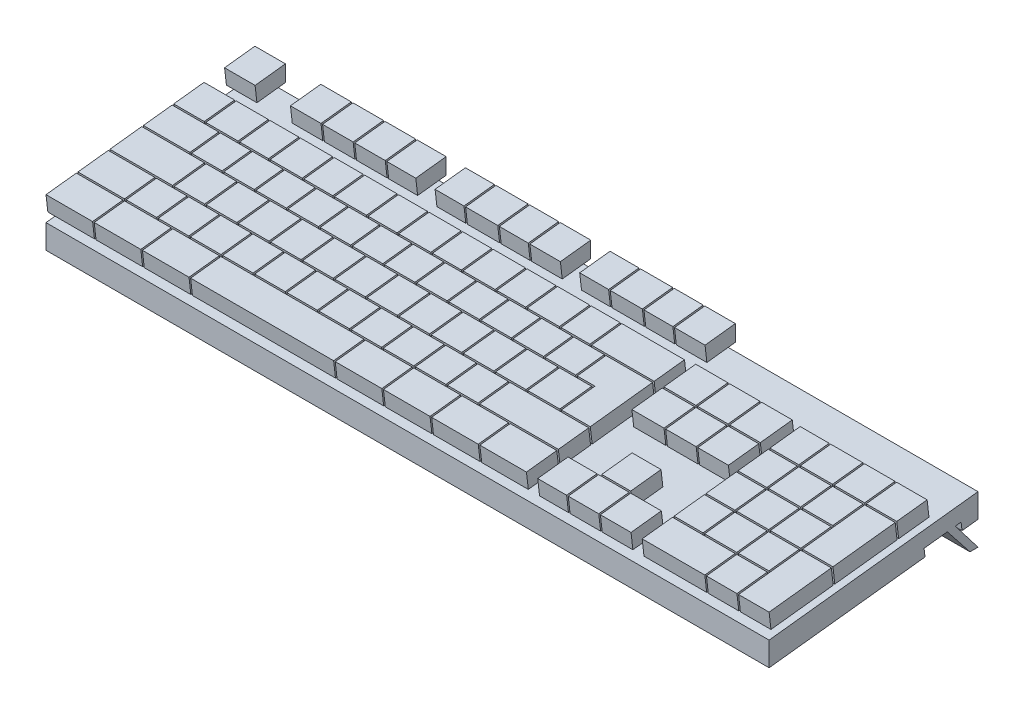
from build123d import *

# Parameters (mm, degrees)
BOSS_EXTRUDE1_DEPTH           = 450
SKETCH2_W                     = 450
SKETCH2_H                     = 23.19613836
CUT_EXTRUDE3_DEPTH            = 5
BOSS_EXTRUDE4_DEPTH           = 450
CUT_EXTRUDE_THIN2_START       = -10
CUT_EXTRUDE_THIN2_OUTLINE_W   = 19
CUT_EXTRUDE_THIN2_OUTLINE_H   = 19
CUT_EXTRUDE_THIN2_OUTLINE_H_2 = 20
CUT_EXTRUDE_THIN2_OUTLINE_H_3 = 18
CUT_EXTRUDE_THIN2_OUTLINE_W_2 = 20
CUT_EXTRUDE_THIN2_OUTLINE_W_3 = 18
CUT_EXTRUDE_THIN2_OUTLINE_W_4 = 49
CUT_EXTRUDE_THIN2_OUTLINE_W_5 = 39
CUT_EXTRUDE_THIN2_OUTLINE_W_6 = 62.079147308
CUT_EXTRUDE_THIN2_OUTLINE_H_4 = 42
CUT_EXTRUDE_THIN2_OUTLINE_W_7 = 19.079147308
CUT_EXTRUDE_THIN2_DEPTH       = 10
CUT_EXTRUDE4_DEPTH            = 450
SKETCH11_W                    = 62.079147308
SKETCH11_H                    = 42
CUT_EXTRUDE6_DEPTH            = 10
CUT_EXTRUDE7_DEPTH            = 450


# Read off the part's stored shape, not the designer's step: Cut-Extrude-Thin2
with BuildPart() as part:
    # Sketch1 → Boss-Extrude1 (new body)
    with BuildSketch(Plane(origin=(0, 0, 0), x_dir=(0, 0, -1), z_dir=(1, 0, 0))):
        Polygon((0, 0), (0, 30), (130, 45), (130, 15), align=None)
    extrude(amount=BOSS_EXTRUDE1_DEPTH)

    # Sketch2 → Cut-Extrude3 (cut)
    with BuildSketch(Plane(origin=(0, 0, 0), x_dir=(1, 0, 0), z_dir=(0, -0.9934089358711312, -0.11462410798513054))):
        with Locations((225, -109.264454103)):
            Rectangle(SKETCH2_W, SKETCH2_H)
    extrude(amount=-CUT_EXTRUDE3_DEPTH, mode=Mode.SUBTRACT)

    # Sketch5 → Boss-Extrude4 (add)
    with BuildSketch(Plane(origin=(450, 0, 0), x_dir=(0, 0, -1), z_dir=(1, 0, 0))):
        Polygon((130, 0), (115.88077903, 18.404033091), (110.913734351, 17.830912551), (125, 0), align=None)
    extrude(amount=-BOSS_EXTRUDE4_DEPTH)

    # Cut-Extrude-Thin2 outline → Cut-Extrude-Thin2 (cut)
    # profile 1 of 6: a face of its own
    with BuildSketch(Plane(origin=(0, 29.605839416, 3.416058394), x_dir=(1, 0, 0), z_dir=(0, 0.9934089358711312, 0.11462410798513054)).offset(CUT_EXTRUDE_THIN2_START)):
        Polygon((29, 23.43872324), (0, 23.43872324), (0, 22.43872324), (29, 22.43872324), (29, 3.43872324), (30, 3.43872324), (30, 22.43872324), (59, 22.43872324), (59, 3.43872324), (60, 3.43872324), (60, 22.43872324), (89, 22.43872324), (89, 3.43872324), (90, 3.43872324), (90, 22.43872324), (179, 22.43872324), (179, 3.43872324), (180, 3.43872324), (180, 22.43872324), (209, 22.43872324), (209, 3.43872324), (210, 3.43872324), (210, 22.43872324), (239, 22.43872324), (239, 3.43872324), (240, 3.43872324), (240, 22.43872324), (269, 22.43872324), (269, 3.43872324), (270, 3.43872324), (270, 22.43872324), (299, 22.43872324), (299, 2.43872324), (306, 2.43872324), (306, 22.43872324), (324, 22.43872324), (324, 3.43872324), (325, 3.43872324), (325, 22.43872324), (344, 22.43872324), (344, 3.43872324), (345, 3.43872324), (345, 22.43872324), (364.079147308, 22.43872324), (364.079147308, 2.43872324), (371, 2.43872324), (371, 22.43872324), (410, 22.43872324), (410, 3.43872324), (411, 3.43872324), (411, 22.43872324), (430, 22.43872324), (430, 3.43872324), (431, 3.43872324), (431, 42.43872324), (450, 42.43872324), (450, 43.43872324), (431, 43.43872324), (431, 82.43872324), (450, 82.43872324), (450, 83.43872324), (431, 83.43872324), (431, 102.43872324), (450, 102.43872324), (450, 103.43872324), (370, 103.43872324), (370, 3.43872324), (365.079147308, 3.43872324), (365.079147308, 23.43872324), (345, 23.43872324), (345, 43.43872324), (325, 43.43872324), (325, 23.43872324), (305, 23.43872324), (305, 3.43872324), (300, 3.43872324), (300, 103.43872324), (0, 103.43872324), (0, 102.43872324), (19, 102.43872324), (19, 83.43872324), (0, 83.43872324), (0, 82.43872324), (29, 82.43872324), (29, 64.43872324), (0, 64.43872324), (0, 63.43872324), (39, 63.43872324), (39, 43.43872324), (0, 43.43872324), (0, 42.43872324), (29, 42.43872324), align=None)
        with Locations((39.5, 32.93872324)):
            Rectangle(CUT_EXTRUDE_THIN2_OUTLINE_W, CUT_EXTRUDE_THIN2_OUTLINE_H, mode=Mode.SUBTRACT)
        with Locations((59.5, 32.93872324)):
            Rectangle(CUT_EXTRUDE_THIN2_OUTLINE_W, CUT_EXTRUDE_THIN2_OUTLINE_H, mode=Mode.SUBTRACT)
        with Locations((49.5, 53.43872324)):
            Rectangle(CUT_EXTRUDE_THIN2_OUTLINE_W, CUT_EXTRUDE_THIN2_OUTLINE_H_2, mode=Mode.SUBTRACT)
        with Locations((79.5, 32.93872324)):
            Rectangle(CUT_EXTRUDE_THIN2_OUTLINE_W, CUT_EXTRUDE_THIN2_OUTLINE_H, mode=Mode.SUBTRACT)
        with Locations((69.5, 53.43872324)):
            Rectangle(CUT_EXTRUDE_THIN2_OUTLINE_W, CUT_EXTRUDE_THIN2_OUTLINE_H_2, mode=Mode.SUBTRACT)
        with Locations((99.5, 32.93872324)):
            Rectangle(CUT_EXTRUDE_THIN2_OUTLINE_W, CUT_EXTRUDE_THIN2_OUTLINE_H, mode=Mode.SUBTRACT)
        with Locations((89.5, 53.43872324)):
            Rectangle(CUT_EXTRUDE_THIN2_OUTLINE_W, CUT_EXTRUDE_THIN2_OUTLINE_H_2, mode=Mode.SUBTRACT)
        with Locations((119.5, 32.93872324)):
            Rectangle(CUT_EXTRUDE_THIN2_OUTLINE_W, CUT_EXTRUDE_THIN2_OUTLINE_H, mode=Mode.SUBTRACT)
        with Locations((139.5, 32.93872324)):
            Rectangle(CUT_EXTRUDE_THIN2_OUTLINE_W, CUT_EXTRUDE_THIN2_OUTLINE_H, mode=Mode.SUBTRACT)
        with Locations((159.5, 32.93872324)):
            Rectangle(CUT_EXTRUDE_THIN2_OUTLINE_W, CUT_EXTRUDE_THIN2_OUTLINE_H, mode=Mode.SUBTRACT)
        with Locations((179.5, 32.93872324)):
            Rectangle(CUT_EXTRUDE_THIN2_OUTLINE_W, CUT_EXTRUDE_THIN2_OUTLINE_H, mode=Mode.SUBTRACT)
        with Locations((39.5, 73.43872324)):
            Rectangle(CUT_EXTRUDE_THIN2_OUTLINE_W, CUT_EXTRUDE_THIN2_OUTLINE_H_3, mode=Mode.SUBTRACT)
        with Locations((30, 92.93872324)):
            Rectangle(CUT_EXTRUDE_THIN2_OUTLINE_W_2, CUT_EXTRUDE_THIN2_OUTLINE_H, mode=Mode.SUBTRACT)
        with Locations((50, 92.93872324)):
            Rectangle(CUT_EXTRUDE_THIN2_OUTLINE_W_3, CUT_EXTRUDE_THIN2_OUTLINE_H, mode=Mode.SUBTRACT)
        with Locations((59.5, 73.43872324)):
            Rectangle(CUT_EXTRUDE_THIN2_OUTLINE_W, CUT_EXTRUDE_THIN2_OUTLINE_H_3, mode=Mode.SUBTRACT)
        with Locations((109.5, 53.43872324)):
            Rectangle(CUT_EXTRUDE_THIN2_OUTLINE_W, CUT_EXTRUDE_THIN2_OUTLINE_H_2, mode=Mode.SUBTRACT)
        with Locations((129.5, 53.43872324)):
            Rectangle(CUT_EXTRUDE_THIN2_OUTLINE_W, CUT_EXTRUDE_THIN2_OUTLINE_H_2, mode=Mode.SUBTRACT)
        with Locations((149.5, 53.43872324)):
            Rectangle(CUT_EXTRUDE_THIN2_OUTLINE_W, CUT_EXTRUDE_THIN2_OUTLINE_H_2, mode=Mode.SUBTRACT)
        with Locations((169.5, 53.43872324)):
            Rectangle(CUT_EXTRUDE_THIN2_OUTLINE_W, CUT_EXTRUDE_THIN2_OUTLINE_H_2, mode=Mode.SUBTRACT)
        with Locations((199.5, 32.93872324)):
            Rectangle(CUT_EXTRUDE_THIN2_OUTLINE_W, CUT_EXTRUDE_THIN2_OUTLINE_H, mode=Mode.SUBTRACT)
        with Locations((70, 92.93872324)):
            Rectangle(CUT_EXTRUDE_THIN2_OUTLINE_W_2, CUT_EXTRUDE_THIN2_OUTLINE_H, mode=Mode.SUBTRACT)
        with Locations((79.5, 73.43872324)):
            Rectangle(CUT_EXTRUDE_THIN2_OUTLINE_W, CUT_EXTRUDE_THIN2_OUTLINE_H_3, mode=Mode.SUBTRACT)
        with Locations((90, 92.93872324)):
            Rectangle(CUT_EXTRUDE_THIN2_OUTLINE_W_3, CUT_EXTRUDE_THIN2_OUTLINE_H, mode=Mode.SUBTRACT)
        with Locations((99.5, 73.43872324)):
            Rectangle(CUT_EXTRUDE_THIN2_OUTLINE_W, CUT_EXTRUDE_THIN2_OUTLINE_H_3, mode=Mode.SUBTRACT)
        with Locations((189.5, 53.43872324)):
            Rectangle(CUT_EXTRUDE_THIN2_OUTLINE_W, CUT_EXTRUDE_THIN2_OUTLINE_H_2, mode=Mode.SUBTRACT)
        with Locations((219.5, 32.93872324)):
            Rectangle(CUT_EXTRUDE_THIN2_OUTLINE_W, CUT_EXTRUDE_THIN2_OUTLINE_H, mode=Mode.SUBTRACT)
        with Locations((209.5, 53.43872324)):
            Rectangle(CUT_EXTRUDE_THIN2_OUTLINE_W, CUT_EXTRUDE_THIN2_OUTLINE_H_2, mode=Mode.SUBTRACT)
        with Locations((239.5, 32.93872324)):
            Rectangle(CUT_EXTRUDE_THIN2_OUTLINE_W, CUT_EXTRUDE_THIN2_OUTLINE_H, mode=Mode.SUBTRACT)
        with Locations((110, 92.93872324)):
            Rectangle(CUT_EXTRUDE_THIN2_OUTLINE_W_2, CUT_EXTRUDE_THIN2_OUTLINE_H, mode=Mode.SUBTRACT)
        with Locations((119.5, 73.43872324)):
            Rectangle(CUT_EXTRUDE_THIN2_OUTLINE_W, CUT_EXTRUDE_THIN2_OUTLINE_H_3, mode=Mode.SUBTRACT)
        with Locations((130, 92.93872324)):
            Rectangle(CUT_EXTRUDE_THIN2_OUTLINE_W_3, CUT_EXTRUDE_THIN2_OUTLINE_H, mode=Mode.SUBTRACT)
        with Locations((139.5, 73.43872324)):
            Rectangle(CUT_EXTRUDE_THIN2_OUTLINE_W, CUT_EXTRUDE_THIN2_OUTLINE_H_3, mode=Mode.SUBTRACT)
        with Locations((150, 92.93872324)):
            Rectangle(CUT_EXTRUDE_THIN2_OUTLINE_W_2, CUT_EXTRUDE_THIN2_OUTLINE_H, mode=Mode.SUBTRACT)
        with Locations((159.5, 73.43872324)):
            Rectangle(CUT_EXTRUDE_THIN2_OUTLINE_W, CUT_EXTRUDE_THIN2_OUTLINE_H_3, mode=Mode.SUBTRACT)
        with Locations((179.5, 73.43872324)):
            Rectangle(CUT_EXTRUDE_THIN2_OUTLINE_W, CUT_EXTRUDE_THIN2_OUTLINE_H_3, mode=Mode.SUBTRACT)
        with Locations((170, 92.93872324)):
            Rectangle(CUT_EXTRUDE_THIN2_OUTLINE_W_3, CUT_EXTRUDE_THIN2_OUTLINE_H, mode=Mode.SUBTRACT)
        with Locations((229.5, 53.43872324)):
            Rectangle(CUT_EXTRUDE_THIN2_OUTLINE_W, CUT_EXTRUDE_THIN2_OUTLINE_H_2, mode=Mode.SUBTRACT)
        with Locations((274.5, 32.93872324)):
            Rectangle(CUT_EXTRUDE_THIN2_OUTLINE_W_4, CUT_EXTRUDE_THIN2_OUTLINE_H, mode=Mode.SUBTRACT)
        with Locations((190, 92.93872324)):
            Rectangle(CUT_EXTRUDE_THIN2_OUTLINE_W_2, CUT_EXTRUDE_THIN2_OUTLINE_H, mode=Mode.SUBTRACT)
        with Locations((199.5, 73.43872324)):
            Rectangle(CUT_EXTRUDE_THIN2_OUTLINE_W, CUT_EXTRUDE_THIN2_OUTLINE_H_3, mode=Mode.SUBTRACT)
        with Locations((249.5, 53.43872324)):
            Rectangle(CUT_EXTRUDE_THIN2_OUTLINE_W, CUT_EXTRUDE_THIN2_OUTLINE_H_2, mode=Mode.SUBTRACT)
        with Locations((210, 92.93872324)):
            Rectangle(CUT_EXTRUDE_THIN2_OUTLINE_W_3, CUT_EXTRUDE_THIN2_OUTLINE_H, mode=Mode.SUBTRACT)
        with Locations((219.5, 73.43872324)):
            Rectangle(CUT_EXTRUDE_THIN2_OUTLINE_W, CUT_EXTRUDE_THIN2_OUTLINE_H_3, mode=Mode.SUBTRACT)
        with Locations((230, 92.93872324)):
            Rectangle(CUT_EXTRUDE_THIN2_OUTLINE_W_2, CUT_EXTRUDE_THIN2_OUTLINE_H, mode=Mode.SUBTRACT)
        with Locations((239.5, 73.43872324)):
            Rectangle(CUT_EXTRUDE_THIN2_OUTLINE_W, CUT_EXTRUDE_THIN2_OUTLINE_H_3, mode=Mode.SUBTRACT)
        with Locations((270, 53.43872324)):
            Rectangle(CUT_EXTRUDE_THIN2_OUTLINE_W_2, CUT_EXTRUDE_THIN2_OUTLINE_H_2, mode=Mode.SUBTRACT)
        Polygon((299, 43.43872324), (281, 43.43872324), (281, 64.43872324), (270, 64.43872324), (270, 82.43872324), (299, 82.43872324), align=None, mode=Mode.SUBTRACT)
        with Locations((250, 92.93872324)):
            Rectangle(CUT_EXTRUDE_THIN2_OUTLINE_W_3, CUT_EXTRUDE_THIN2_OUTLINE_H, mode=Mode.SUBTRACT)
        with Locations((259.5, 73.43872324)):
            Rectangle(CUT_EXTRUDE_THIN2_OUTLINE_W, CUT_EXTRUDE_THIN2_OUTLINE_H_3, mode=Mode.SUBTRACT)
        with Locations((279.5, 92.93872324)):
            Rectangle(CUT_EXTRUDE_THIN2_OUTLINE_W_5, CUT_EXTRUDE_THIN2_OUTLINE_H, mode=Mode.SUBTRACT)
        with Locations((335, 32.93872324)):
            Rectangle(CUT_EXTRUDE_THIN2_OUTLINE_W_3, CUT_EXTRUDE_THIN2_OUTLINE_H, mode=Mode.SUBTRACT)
        with Locations((380, 32.93872324)):
            Rectangle(CUT_EXTRUDE_THIN2_OUTLINE_W_3, CUT_EXTRUDE_THIN2_OUTLINE_H, mode=Mode.SUBTRACT)
        with Locations((400, 32.93872324)):
            Rectangle(CUT_EXTRUDE_THIN2_OUTLINE_W_2, CUT_EXTRUDE_THIN2_OUTLINE_H, mode=Mode.SUBTRACT)
        with Locations((380, 52.93872324)):
            Rectangle(CUT_EXTRUDE_THIN2_OUTLINE_W_3, CUT_EXTRUDE_THIN2_OUTLINE_H, mode=Mode.SUBTRACT)
        with Locations((420.5, 32.93872324)):
            Rectangle(CUT_EXTRUDE_THIN2_OUTLINE_W, CUT_EXTRUDE_THIN2_OUTLINE_H, mode=Mode.SUBTRACT)
        with Locations((380, 72.93872324)):
            Rectangle(CUT_EXTRUDE_THIN2_OUTLINE_W_3, CUT_EXTRUDE_THIN2_OUTLINE_H, mode=Mode.SUBTRACT)
        with Locations((400, 52.93872324)):
            Rectangle(CUT_EXTRUDE_THIN2_OUTLINE_W_2, CUT_EXTRUDE_THIN2_OUTLINE_H, mode=Mode.SUBTRACT)
        with Locations((420.5, 52.93872324)):
            Rectangle(CUT_EXTRUDE_THIN2_OUTLINE_W, CUT_EXTRUDE_THIN2_OUTLINE_H, mode=Mode.SUBTRACT)
        with Locations((380, 92.93872324)):
            Rectangle(CUT_EXTRUDE_THIN2_OUTLINE_W_3, CUT_EXTRUDE_THIN2_OUTLINE_H, mode=Mode.SUBTRACT)
        with Locations((400, 72.93872324)):
            Rectangle(CUT_EXTRUDE_THIN2_OUTLINE_W_2, CUT_EXTRUDE_THIN2_OUTLINE_H, mode=Mode.SUBTRACT)
        with Locations((420.5, 72.93872324)):
            Rectangle(CUT_EXTRUDE_THIN2_OUTLINE_W, CUT_EXTRUDE_THIN2_OUTLINE_H, mode=Mode.SUBTRACT)
        with Locations((400, 92.93872324)):
            Rectangle(CUT_EXTRUDE_THIN2_OUTLINE_W_2, CUT_EXTRUDE_THIN2_OUTLINE_H, mode=Mode.SUBTRACT)
        with Locations((420.5, 92.93872324)):
            Rectangle(CUT_EXTRUDE_THIN2_OUTLINE_W, CUT_EXTRUDE_THIN2_OUTLINE_H, mode=Mode.SUBTRACT)
    # profile 2 of 6: a face of its own
    with BuildSketch(Plane(origin=(0, 29.605839416, 3.416058394), x_dir=(1, 0, 0), z_dir=(0, 0.9934089358711312, 0.11462410798513054)).offset(CUT_EXTRUDE_THIN2_START)):
        Polygon((0, 115.301246523), (0, 114.301246523), (20, 114.301246523), (20, 134.301246523), (19, 134.301246523), (19, 115.301246523), align=None)
    # profile 3 of 6: a face of its own
    with BuildSketch(Plane(origin=(0, 29.605839416, 3.416058394), x_dir=(1, 0, 0), z_dir=(0, 0.9934089358711312, 0.11462410798513054)).offset(CUT_EXTRUDE_THIN2_START)):
        Polygon((41, 134.301246523), (40, 134.301246523), (40, 114.301246523), (120, 114.301246523), (120, 134.301246523), (119, 134.301246523), (119, 115.301246523), (101, 115.301246523), (101, 134.301246523), (100, 134.301246523), (100, 115.301246523), (81, 115.301246523), (81, 134.301246523), (80, 134.301246523), (80, 115.301246523), (61, 115.301246523), (61, 134.301246523), (60, 134.301246523), (60, 115.301246523), (41, 115.301246523), align=None)
    # profile 4 of 6: a face of its own
    with BuildSketch(Plane(origin=(0, 29.605839416, 3.416058394), x_dir=(1, 0, 0), z_dir=(0, 0.9934089358711312, 0.11462410798513054)).offset(CUT_EXTRUDE_THIN2_START)):
        Polygon((131, 134.301246523), (130, 134.301246523), (130, 114.301246523), (210, 114.301246523), (210, 134.301246523), (209, 134.301246523), (209, 115.301246523), (190, 115.301246523), (190, 134.301246523), (189, 134.301246523), (189, 115.301246523), (171, 115.301246523), (171, 134.301246523), (170, 134.301246523), (170, 115.301246523), (150, 115.301246523), (150, 134.301246523), (149, 134.301246523), (149, 115.301246523), (131, 115.301246523), align=None)
    # profile 5 of 6: a face of its own
    with BuildSketch(Plane(origin=(0, 29.605839416, 3.416058394), x_dir=(1, 0, 0), z_dir=(0, 0.9934089358711312, 0.11462410798513054)).offset(CUT_EXTRUDE_THIN2_START)):
        Polygon((221, 134.301246523), (220, 134.301246523), (220, 114.301246523), (300, 114.301246523), (300, 134.301246523), (299, 134.301246523), (299, 115.301246523), (280, 115.301246523), (280, 134.301246523), (279, 134.301246523), (279, 115.301246523), (261, 115.301246523), (261, 134.301246523), (260, 134.301246523), (260, 115.301246523), (240, 115.301246523), (240, 134.301246523), (239, 134.301246523), (239, 115.301246523), (221, 115.301246523), align=None)
    # profile 6 of 6: a face of its own
    with BuildSketch(Plane(origin=(0, 29.605839416, 3.416058394), x_dir=(1, 0, 0), z_dir=(0, 0.9934089358711312, 0.11462410798513054)).offset(CUT_EXTRUDE_THIN2_START)):
        with Locations((335.039573654, 83.43872324)):
            Rectangle(CUT_EXTRUDE_THIN2_OUTLINE_W_6, CUT_EXTRUDE_THIN2_OUTLINE_H_4)
        with Locations((315, 93.43872324)):
            Rectangle(CUT_EXTRUDE_THIN2_OUTLINE_W_2, CUT_EXTRUDE_THIN2_OUTLINE_H_2, mode=Mode.SUBTRACT)
        with Locations((315, 72.93872324)):
            Rectangle(CUT_EXTRUDE_THIN2_OUTLINE_W_2, CUT_EXTRUDE_THIN2_OUTLINE_H, mode=Mode.SUBTRACT)
        with Locations((335.5, 93.43872324)):
            Rectangle(CUT_EXTRUDE_THIN2_OUTLINE_W, CUT_EXTRUDE_THIN2_OUTLINE_H_2, mode=Mode.SUBTRACT)
        with Locations((335.5, 72.93872324)):
            Rectangle(CUT_EXTRUDE_THIN2_OUTLINE_W, CUT_EXTRUDE_THIN2_OUTLINE_H, mode=Mode.SUBTRACT)
        with Locations((355.539573654, 72.93872324)):
            Rectangle(CUT_EXTRUDE_THIN2_OUTLINE_W_7, CUT_EXTRUDE_THIN2_OUTLINE_H, mode=Mode.SUBTRACT)
        with Locations((355.539573654, 93.43872324)):
            Rectangle(CUT_EXTRUDE_THIN2_OUTLINE_W_7, CUT_EXTRUDE_THIN2_OUTLINE_H_2, mode=Mode.SUBTRACT)
    extrude(amount=CUT_EXTRUDE_THIN2_DEPTH, mode=Mode.SUBTRACT)

    # Sketch8 → Cut-Extrude4 (cut)
    with BuildSketch(Plane.ZY):
        Polygon((-112.271471298, 32.88805259), (-20.021010861, 22.243768693), (0, 19.933652055), (0, 14.933652055), (-130, 29.933652055), (-130, 34.933652055), align=None)
    extrude(amount=-CUT_EXTRUDE4_DEPTH, mode=Mode.SUBTRACT)

    # Sketch11 → Cut-Extrude6 (cut)
    with BuildSketch(Plane(origin=(0, 29.605839416, 3.416058394), x_dir=(1, 0, 0), z_dir=(0, 0.9934089358711312, 0.11462410798513054))):
        Polygon((0, 114.301246523), (0, 103.43872324), (300, 103.43872324), (300, 3.43872324), (305, 3.43872324), (305, 23.43872324), (325, 23.43872324), (325, 43.43872324), (345, 43.43872324), (345, 23.43872324), (365.079147308, 23.43872324), (365.079147308, 3.43872324), (370, 3.43872324), (370, 103.43872324), (450, 103.43872324), (450, 134.301246523), (300, 134.301246523), (300, 114.301246523), (220, 114.301246523), (220, 134.301246523), (210, 134.301246523), (210, 114.301246523), (130, 114.301246523), (130, 134.301246523), (120, 134.301246523), (120, 114.301246523), (40, 114.301246523), (40, 134.301246523), (20, 134.301246523), (20, 114.301246523), align=None)
        with Locations((335.039573654, 83.43872324)):
            Rectangle(SKETCH11_W, SKETCH11_H, mode=Mode.SUBTRACT)
    extrude(amount=-CUT_EXTRUDE6_DEPTH, mode=Mode.SUBTRACT)

    # Sketch13 → Cut-Extrude7 (cut)
    with BuildSketch(Plane(origin=(0, 0, 0), x_dir=(0, 0, -1), z_dir=(1, 0, 0))):
        Polygon((0, 30), (1.14624108, 20.065910641), (0, 19.933652055), align=None)
    extrude(amount=CUT_EXTRUDE7_DEPTH, mode=Mode.SUBTRACT)


solid = part.part
